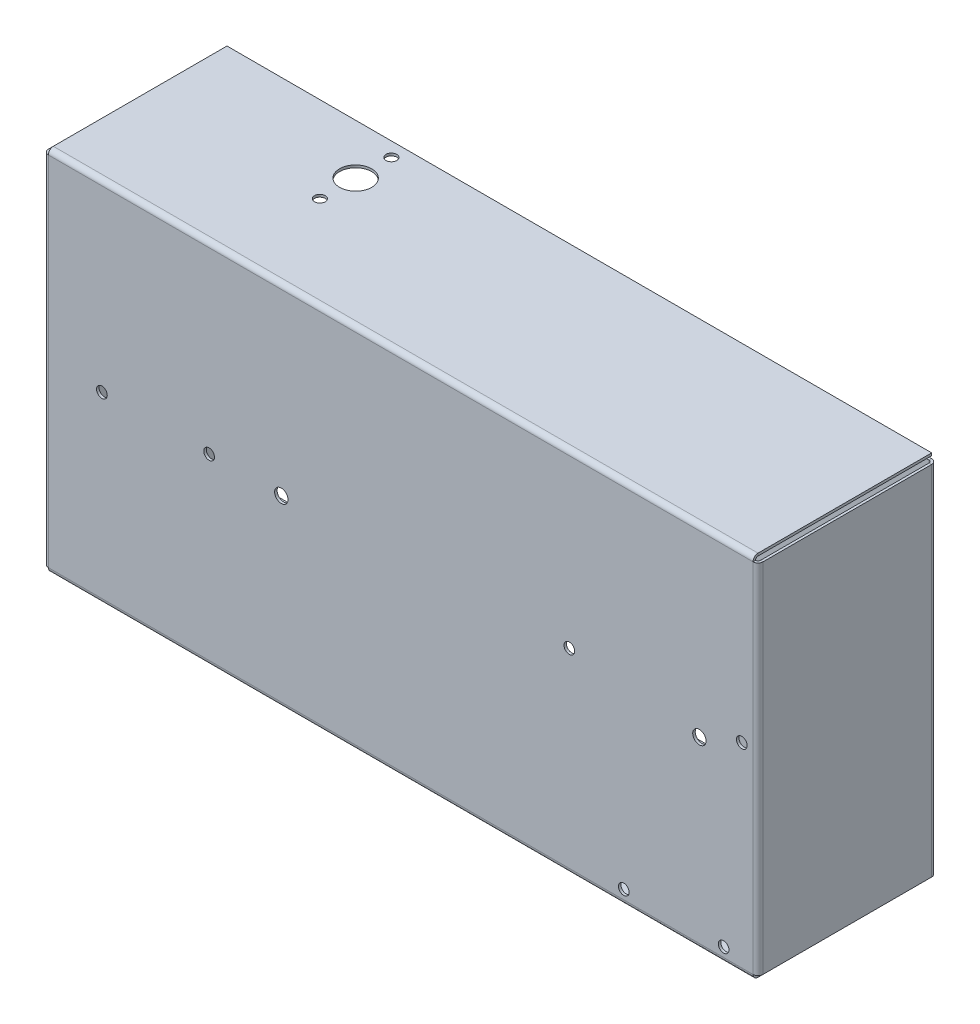
from build123d import *

# Parameters (mm, degrees)
BASE_FLANGE1_DEPTH = 100
EDGE_FLANGE1_DEPTH = 197.2
EDGE_FLANGE2_DEPTH = 197.2
HOLE1_START        = -1.4
HOLE1_OUTLINE_R    = 4.5
HOLE1_OUTLINE_R_2  = 1.5
HOLE1_DEPTH        = 102.8
CUT_EXTRUDE2_REACH = 231.743
SKETCH20_R         = 1.21
CUT_EXTRUDE3_REACH = 231.743
SKETCH22_R         = 1.5
SKETCH22_R_2       = 1.87
CUT_EXTRUDE4_REACH = 231.743
SKETCH25_R         = 1.5


# Read off the part's stored shape, not the designer's step: Hole1
# Sheet-metal steps are written as plain solids
with BuildPart() as part:
    # Sketch1 → Base-Flange1 (new body)
    with BuildSketch(Plane(origin=(0, 0, 0), x_dir=(1, 0, 0), z_dir=(0, 1, 0))):
        with BuildLine():
            Line((0, 50), (0, 1.4))
            ThreePointArc((0, 1.4), (0.410050506, 0.410050506), (1.4, 0))
            Line((1.4, 0), (198.6, 0))
            ThreePointArc((198.6, 0), (199.589949494, 0.410050506), (200, 1.4))
            Line((200, 1.4), (200, 48.6))
            ThreePointArc((200, 48.6), (199.589949494, 49.589949494), (198.6, 50))
            Line((198.6, 50), (145, 50))
            Line((145, 50), (145, 49.3))
            Line((145, 49.3), (198.6, 49.3))
            ThreePointArc((198.6, 49.3), (199.094974747, 49.094974747), (199.3, 48.6))
            Line((199.3, 48.6), (199.3, 1.4))
            ThreePointArc((199.3, 1.4), (199.094974747, 0.905025253), (198.6, 0.7))
            Line((198.6, 0.7), (1.4, 0.7))
            ThreePointArc((1.4, 0.7), (0.905025253, 0.905025253), (0.7, 1.4))
            Line((0.7, 1.4), (0.7, 50))
            Line((0.7, 50), (0, 50))
        make_face()
    extrude(amount=BASE_FLANGE1_DEPTH)

    # Edge-Flange1 section (across the edge) → Edge-Flange1 (add)
    with BuildSketch(Plane(origin=(198.6, -0.7, -0.7), x_dir=(0, 1, 0), z_dir=(-1, 0, 0))):
        with BuildLine():
            Line((-0.7, 0.7), (-0.7, 49.3))
            Line((-0.7, 49.3), (0, 49.3))
            Line((0, 49.3), (0, 0.7))
            ThreePointArc((0, 0.7), (0.205025253, 0.205025253), (0.7, 0))
            Line((0.7, 0), (0.7, -0.7))
            ThreePointArc((0.7, -0.7), (-0.289949494, -0.289949494), (-0.7, 0.7))
        make_face()
    extrude(amount=EDGE_FLANGE1_DEPTH)

    # Edge-Flange2 section (across the edge) → Edge-Flange2 (add)
    with BuildSketch(Plane(origin=(1.4, 100.7, -0.7), x_dir=(0, -1, 0), z_dir=(1, 0, 0))):
        with BuildLine():
            Line((-0.7, 0.7), (-0.7, 49.3))
            Line((-0.7, 49.3), (0, 49.3))
            Line((0, 49.3), (0, 0.7))
            ThreePointArc((0, 0.7), (0.205025253, 0.205025253), (0.7, 0))
            Line((0.7, 0), (0.7, -0.7))
            ThreePointArc((0.7, -0.7), (-0.289949494, -0.289949494), (-0.7, 0.7))
        make_face()
    extrude(amount=EDGE_FLANGE2_DEPTH)

    # Hole1 outline → Hole1 (cut)
    with BuildSketch(Plane(origin=(0, 0, 0), x_dir=(1, 0, 0), z_dir=(0, 1, 0)).offset(HOLE1_START)):
        with Locations((51.4, 36)):
            Circle(HOLE1_OUTLINE_R)
        with Locations((51.4, 26)):
            Circle(HOLE1_OUTLINE_R_2)
        with Locations((51.4, 46)):
            Circle(HOLE1_OUTLINE_R_2)
    extrude(amount=HOLE1_DEPTH, mode=Mode.SUBTRACT)

    # Sketch20 → Cut-Extrude2 (cut, up to next)
    with BuildSketch(Plane(origin=(0, 0, -50), x_dir=(-1, 0, 0), z_dir=(0, 0, -1)), mode=Mode.PRIVATE) as cut_extrude2_sk1:
        with Locations((-160, 57.75)):
            Circle(SKETCH20_R)
    cut_extrude2_tool1 = extrude(cut_extrude2_sk1.sketch, amount=-CUT_EXTRUDE2_REACH, mode=Mode.PRIVATE) & part.part
    # Sketch20 → Cut-Extrude2 (cut, up to next)
    with BuildSketch(Plane(origin=(0, 0, -50), x_dir=(-1, 0, 0), z_dir=(0, 0, -1)), mode=Mode.PRIVATE) as cut_extrude2_sk2:
        with Locations((-160, 42.25)):
            Circle(SKETCH20_R)
    cut_extrude2_tool2 = extrude(cut_extrude2_sk2.sketch, amount=-CUT_EXTRUDE2_REACH, mode=Mode.PRIVATE) & part.part
    add(cut_extrude2_tool1.solids().sort_by_distance((160, 57.75, -50))[0], mode=Mode.SUBTRACT)
    add(cut_extrude2_tool2.solids().sort_by_distance((160, 42.25, -50))[0], mode=Mode.SUBTRACT)

    # Sketch22 → Cut-Extrude3 (cut, up to next)
    with BuildSketch(Plane.XY, mode=Mode.PRIVATE) as cut_extrude3_sk1:
        with Locations((16.4, 50)):
            Circle(SKETCH22_R)
    cut_extrude3_tool1 = extrude(cut_extrude3_sk1.sketch, amount=-CUT_EXTRUDE3_REACH, mode=Mode.PRIVATE) & part.part
    # Sketch22 → Cut-Extrude3 (cut, up to next)
    with BuildSketch(Plane.XY, mode=Mode.PRIVATE) as cut_extrude3_sk2:
        with Locations((46.4, 50)):
            Circle(SKETCH22_R)
    cut_extrude3_tool2 = extrude(cut_extrude3_sk2.sketch, amount=-CUT_EXTRUDE3_REACH, mode=Mode.PRIVATE) & part.part
    # Sketch22 → Cut-Extrude3 (cut, up to next)
    with BuildSketch(Plane.XY, mode=Mode.PRIVATE) as cut_extrude3_sk3:
        with Locations((66.6, 50)):
            Circle(SKETCH22_R_2)
    cut_extrude3_tool3 = extrude(cut_extrude3_sk3.sketch, amount=-CUT_EXTRUDE3_REACH, mode=Mode.PRIVATE) & part.part
    # Sketch22 → Cut-Extrude3 (cut, up to next)
    with BuildSketch(Plane.XY, mode=Mode.PRIVATE) as cut_extrude3_sk4:
        with Locations((183.6, 50)):
            Circle(SKETCH22_R_2)
    cut_extrude3_tool4 = extrude(cut_extrude3_sk4.sketch, amount=-CUT_EXTRUDE3_REACH, mode=Mode.PRIVATE) & part.part
    add(cut_extrude3_tool1.solids().sort_by_distance((16.4, 50, 0))[0], mode=Mode.SUBTRACT)
    add(cut_extrude3_tool2.solids().sort_by_distance((46.4, 50, 0))[0], mode=Mode.SUBTRACT)
    add(cut_extrude3_tool3.solids().sort_by_distance((66.6, 50, 0))[0], mode=Mode.SUBTRACT)
    add(cut_extrude3_tool4.solids().sort_by_distance((183.6, 50, 0))[0], mode=Mode.SUBTRACT)

    # Sketch25 → Cut-Extrude4 (cut, up to next)
    with BuildSketch(Plane.XY, mode=Mode.PRIVATE) as cut_extrude4_sk1:
        with Locations((190.38, 2.56)):
            Circle(SKETCH25_R)
    cut_extrude4_tool1 = extrude(cut_extrude4_sk1.sketch, amount=-CUT_EXTRUDE4_REACH, mode=Mode.PRIVATE) & part.part
    # Sketch25 → Cut-Extrude4 (cut, up to next)
    with BuildSketch(Plane.XY, mode=Mode.PRIVATE) as cut_extrude4_sk2:
        with Locations((162.44, 2.56)):
            Circle(SKETCH25_R)
    cut_extrude4_tool2 = extrude(cut_extrude4_sk2.sketch, amount=-CUT_EXTRUDE4_REACH, mode=Mode.PRIVATE) & part.part
    # Sketch25 → Cut-Extrude4 (cut, up to next)
    with BuildSketch(Plane.XY, mode=Mode.PRIVATE) as cut_extrude4_sk3:
        with Locations((195.46, 54.63)):
            Circle(SKETCH25_R)
    cut_extrude4_tool3 = extrude(cut_extrude4_sk3.sketch, amount=-CUT_EXTRUDE4_REACH, mode=Mode.PRIVATE) & part.part
    # Sketch25 → Cut-Extrude4 (cut, up to next)
    with BuildSketch(Plane.XY, mode=Mode.PRIVATE) as cut_extrude4_sk4:
        with Locations((147.2, 53.36)):
            Circle(SKETCH25_R)
    cut_extrude4_tool4 = extrude(cut_extrude4_sk4.sketch, amount=-CUT_EXTRUDE4_REACH, mode=Mode.PRIVATE) & part.part
    add(cut_extrude4_tool1.solids().sort_by_distance((190.38, 2.56, 0))[0], mode=Mode.SUBTRACT)
    add(cut_extrude4_tool2.solids().sort_by_distance((162.44, 2.56, 0))[0], mode=Mode.SUBTRACT)
    add(cut_extrude4_tool3.solids().sort_by_distance((195.46, 54.63, 0))[0], mode=Mode.SUBTRACT)
    add(cut_extrude4_tool4.solids().sort_by_distance((147.2, 53.36, 0))[0], mode=Mode.SUBTRACT)


solid = part.part
